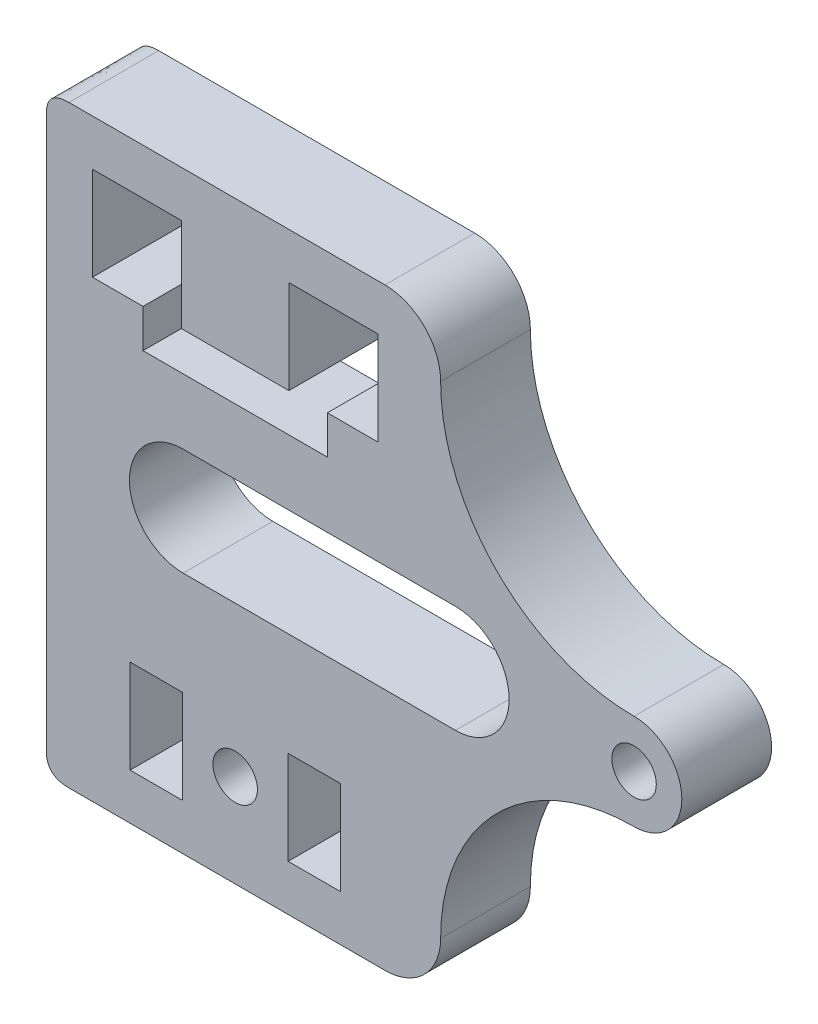
from build123d import *

# Parameters (mm, degrees)
SKETCH1_R           = 1.45
SKETCH1_W           = 3.400011
SKETCH1_H           = 6.1
BOSS_EXTRUDE2_DEPTH = 5.85
SKETCH2_R           = 1.25
CUT_EXTRUDE1_DEPTH  = 1


with BuildPart() as part:
    # Sketch1 → Boss-Extrude2 (new body)
    with BuildSketch(Plane.XY):
        with BuildLine():
            Line((388.726767911, 563.988903138), (409.324633118, 563.988903138))
            ThreePointArc((409.324633118, 563.988903138), (411.889147311, 562.926646578), (412.95140387, 560.362132386))
            ThreePointArc((412.95140387, 560.362132386), (416.644097047, 551.447182437), (425.559046996, 547.75448926))
            ThreePointArc((425.559046996, 547.75448926), (428.674633118, 544.638903138), (425.559046996, 541.523317015))
            ThreePointArc((425.559046996, 541.523317015), (416.644097047, 537.830623838), (412.95140387, 528.915673889))
            ThreePointArc((412.95140387, 528.915673889), (411.889147311, 526.351159697), (409.324633118, 525.288903138))
            Line((409.324633118, 525.288903138), (388.726767911, 525.288903138))
            add(Edge.make_bspline(
                [(387.259046996, 526.755123104), (387.178267168, 525.288903138), (388.726767911, 525.288903138)],
                knots=[0, 0, 0, 1, 1, 1], degree=2))
            Line((387.259046996, 526.755123104), (387.259046996, 562.522682445))
            add(Edge.make_bspline(
                [(387.259046996, 562.522682445), (387.178266356, 563.988903138), (388.726767911, 563.988903138)],
                knots=[0, 0, 0, 1, 1, 1], degree=2))
        make_face()
        with Locations((425.559046996, 544.638903138)):
            Circle(SKETCH1_R, mode=Mode.SUBTRACT)
        with Locations((399.559046996, 531.338903138)):
            Circle(SKETCH1_R, mode=Mode.SUBTRACT)
        Polygon((405.566920996, 552.388903138), (405.566920996, 554.888903138), (408.859046996, 554.888903138), (408.859046996, 560.988903138), (403.059046996, 560.988903138), (403.059046996, 554.888903138), (396.059046996, 554.888903138), (396.059046996, 560.988903138), (390.259046996, 560.988903138), (390.259046996, 554.888903138), (393.551172996, 554.888903138), (393.551172996, 552.388903138), align=None, mode=Mode.SUBTRACT)
        with Locations((394.409041496, 531.338903138)):
            Rectangle(SKETCH1_W, SKETCH1_H, mode=Mode.SUBTRACT)
        with Locations((404.709052496, 531.338903138)):
            Rectangle(SKETCH1_W, SKETCH1_H, mode=Mode.SUBTRACT)
        with BuildLine():
            Line((396.165690223, 548.138903138), (413.915690223, 548.138903138))
            ThreePointArc((413.915690223, 548.138903138), (417.415690223, 544.638903138), (413.915690223, 541.138903138))
            Line((413.915690223, 541.138903138), (396.165690223, 541.138903138))
            ThreePointArc((396.165690223, 541.138903138), (392.665690223, 544.638903138), (396.165690223, 548.138903138))
        make_face(mode=Mode.SUBTRACT)
    extrude(amount=BOSS_EXTRUDE2_DEPTH)

    # Sketch2 → Cut-Extrude1 (cut)
    with BuildSketch(Plane.XY):
        with Locations((409.659057996, 531.338903138)):
            Circle(SKETCH2_R)
    extrude(amount=CUT_EXTRUDE1_DEPTH, mode=Mode.SUBTRACT)


solid = part.part
